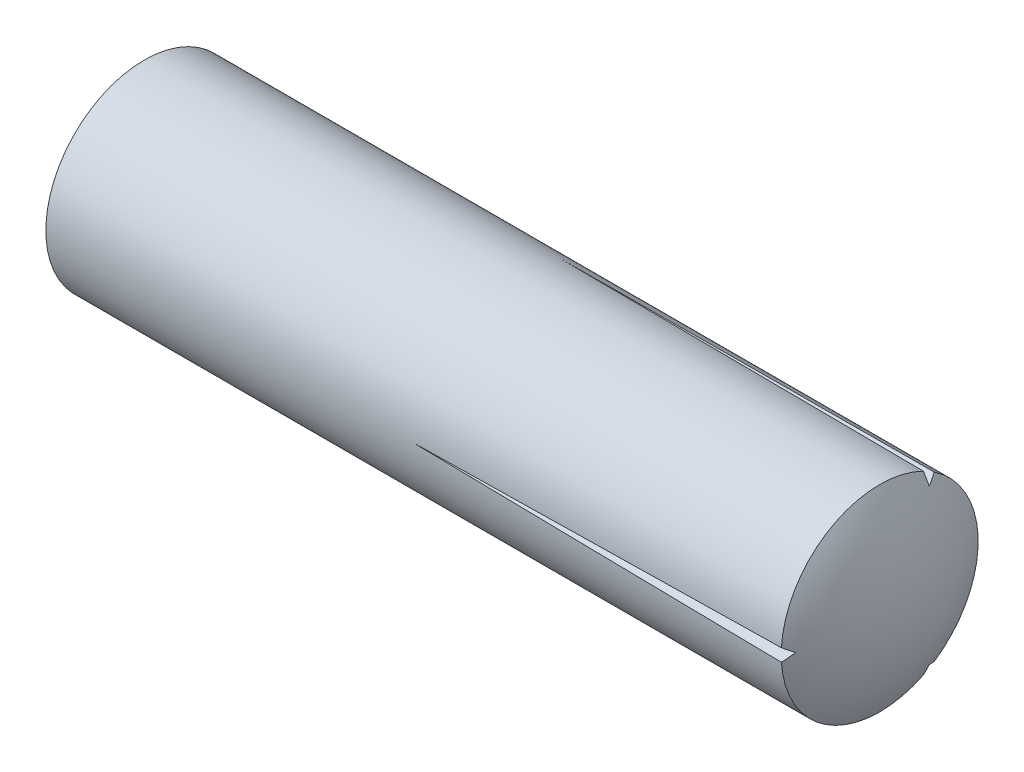
from build123d import *

# Parameters (mm, degrees)
CIRPATTERN1_COUNT = 3


with BuildPart() as part:
    # Sketch1 → Base-Revolve (revolve)
    with BuildSketch(Plane.XY):
        with BuildLine():
            Line((-100, 0), (-100, 1.25))
            ThreePointArc((-100, 1.25), (-99.010050505, 7.072345027), (-96.68190465, 12.5))
            Line((-96.68190465, 12.5), (-3.349364905, 12.5))
            ThreePointArc((-3.349364905, 12.5), (-0.851854343, 6.470476128), (0, 0))
            Line((0, 0), (-100, 0))
        make_face()
    revolve(axis=Axis((-40, 0, 0), (1, 0, 0)))

    # Cut-Sweep1: sweep along a path in Sketch4
    with BuildLine(Plane(origin=(0, 0, 0), x_dir=(1, 0, 0), z_dir=(0, 1, 0))) as cut_sweep1_path:
        Line((0, -11.25), (-50, -12.5))
    # Sketch2 → Cut-Sweep1 (sweep, cut)
    with BuildSketch(Plane(origin=(0, 0, 0), x_dir=(0, 0, -1), z_dir=(1, 0, 0))):
        Polygon((-11.25, 0), (-12.5, 0.875259423), (-12.5, -0.875259423), align=None)
    cut_sweep1 = sweep(path=cut_sweep1_path.line, mode=Mode.SUBTRACT)

    # CirPattern1: Cut-Sweep1 ×3 about axis
    cirpattern1_axis = Axis((-40, 0, 0), (1, 0, 0))
    for i in range(1, CIRPATTERN1_COUNT):
        add(cut_sweep1.rotate(cirpattern1_axis, i * 360 / CIRPATTERN1_COUNT), mode=Mode.SUBTRACT)


solid = part.part
